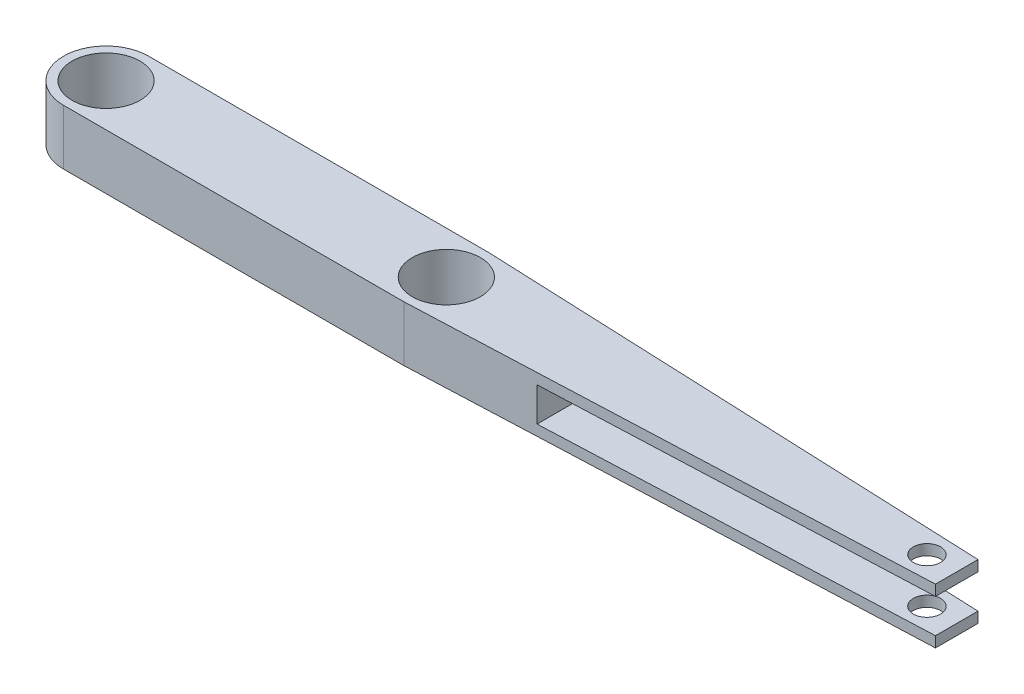
from build123d import *

# Parameters (mm, degrees)
SKETCH_1_R          = 4
EXTRUDE_1_DEPTH     = 6.5
SKETCH_2_R          = 1.6
CUT_EXTRUDE_3_DEPTH = 10
SKETCH_6_W          = 44.960988289
SKETCH_6_H          = 4
CUT_EXTRUDE_4_DEPTH = 10


with BuildPart() as part:
    # 草图1 → 凸台-拉伸1 (new body)
    with BuildSketch(Plane(origin=(0, 0, 0), x_dir=(1, 0, 0), z_dir=(0, 1, 0))):
        with BuildLine():
            ThreePointArc((0, 5), (-5, 0), (0, -5))
            Line((0, -5), (40, -5))
            Line((40, -5), (100, -2.5))
            Line((100, -2.5), (100, 2.5))
            Line((100, 2.5), (40, 5))
            Line((40, 5), (0, 5))
        make_face()
        Circle(SKETCH_1_R, mode=Mode.SUBTRACT)
        with Locations((40, 0)):
            Circle(SKETCH_1_R, mode=Mode.SUBTRACT)
    extrude(amount=EXTRUDE_1_DEPTH)

    # 草图2 → 切除-拉伸3 (cut)
    with BuildSketch(Plane(origin=(0, 6.5, 0), x_dir=(1, 0, 0), z_dir=(0, 1, 0))):
        with Locations((96.5, 0)):
            Circle(SKETCH_2_R)
    extrude(amount=-CUT_EXTRUDE_3_DEPTH, mode=Mode.SUBTRACT)

    # 草图6 → 切除-拉伸4 (cut)
    with BuildSketch(Plane(origin=(0, 0, -5), x_dir=(-1, 0, 0), z_dir=(0, 0, -1))):
        with Locations((-77.519505856, 3.25)):
            Rectangle(SKETCH_6_W, SKETCH_6_H)
    extrude(amount=-CUT_EXTRUDE_4_DEPTH, mode=Mode.SUBTRACT)


solid = part.part
